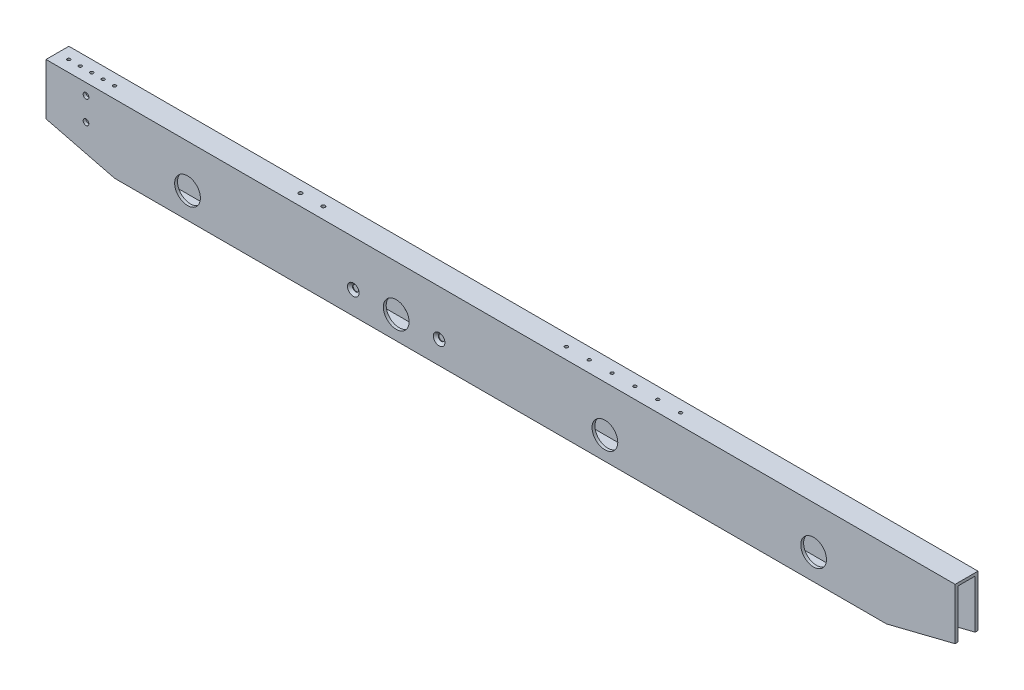
from build123d import *

# Parameters (mm, degrees)
SKETCH1_W                                           = 1009.65
SKETCH1_H                                           = 76.2
SKETCH1_R                                           = 14.2875
BOSS_EXTRUDE2_DEPTH                                 = 12.7
SKETCH3_W                                           = 19.05
SKETCH3_H                                           = 69.85
CUT_EXTRUDE2_DEPTH                                  = 1011.448426442
CUT_EXTRUDE3_DEPTH                                  = 507.897475457
SKETCH9_R                                           = 1.7272
CUT_EXTRUDE5_DEPTH                                  = 6.35
SKETCH12_R                                          = 1.7272
CUT_EXTRUDE8_DEPTH                                  = 5.08
CSK_FOR_1_4_FLAT_HEAD_MACHINE_SCREW_100_D           = 6.7564
CSK_FOR_1_4_FLAT_HEAD_MACHINE_SCREW_100_CSINK_D     = 12.8778
CSK_FOR_1_4_FLAT_HEAD_MACHINE_SCREW_100_CSINK_ANGLE = 100
CUT_EXTRUDE9_START                                  = -6.35
SKETCH15_R                                          = 1.7272
CUT_EXTRUDE9_DEPTH                                  = 6.35
SKETCH16_R                                          = 17.4625
CUT_EXTRUDE10_DEPTH                                 = 3.81
F_1_4_0_25_DIAMETER_HOLE1_D                         = 6.35
F_10_32_TAPPED_HOLE3_D                              = 4.0386


with BuildPart() as part:
    # Sketch1 → Boss-Extrude2 (new, symmetric)
    with BuildSketch(Plane.XY):
        Rectangle(SKETCH1_W, SKETCH1_H)
        with Locations((115.8875, -12.7)):
            Circle(SKETCH1_R, mode=Mode.SUBTRACT)
        with Locations((-347.6625, -9.525)):
            Circle(SKETCH1_R, mode=Mode.SUBTRACT)
        with Locations((347.6625, -9.525)):
            Circle(SKETCH1_R, mode=Mode.SUBTRACT)
        with Locations((-115.8875, -12.7)):
            Circle(SKETCH1_R, mode=Mode.SUBTRACT)
    extrude(amount=BOSS_EXTRUDE2_DEPTH, both=True)

    # Sketch3 → Cut-Extrude2 (cut, through all)
    with BuildSketch(Plane(origin=(504.825, 0, 0), x_dir=(0, 0, -1), z_dir=(1, 0, 0))):
        Rectangle(SKETCH3_W, SKETCH3_H)
    extrude(amount=-CUT_EXTRUDE2_DEPTH, mode=Mode.SUBTRACT)

    # Sketch4 → Cut-Extrude3 (cut, through all)
    with BuildSketch(Plane.XY.offset(12.7)):
        Polygon((-504.825, -38.1), (-504.825, -19.05), (-428.625, -38.1), align=None)
        Polygon((428.625, -38.1), (504.825, -38.1), (504.825, -19.05), align=None)
    extrude(amount=-CUT_EXTRUDE3_DEPTH, mode=Mode.SUBTRACT)

    # Sketch9 → Cut-Extrude5 (cut)
    with BuildSketch(Plane(origin=(0, 38.1, 0), x_dir=(1, 0, 0), z_dir=(0, 1, 0))):
        with Locations((-492.125, 0)):
            Circle(SKETCH9_R)
        with Locations((-441.325, 0)):
            Circle(SKETCH9_R)
        with Locations((-479.425, 0)):
            Circle(SKETCH9_R)
        with Locations((-466.725, 0)):
            Circle(SKETCH9_R)
        with Locations((-454.025, 0)):
            Circle(SKETCH9_R)
    extrude(amount=-CUT_EXTRUDE5_DEPTH, mode=Mode.SUBTRACT)

    # Sketch12 → Cut-Extrude8 (cut)
    with BuildSketch(Plane(origin=(0, 38.1, 0), x_dir=(1, 0, 0), z_dir=(0, 1, 0))):
        with Locations((187.325, 0)):
            Circle(SKETCH12_R)
        with Locations((161.925, 0)):
            Circle(SKETCH12_R)
        with Locations((136.525, 0)):
            Circle(SKETCH12_R)
        with Locations((111.125, 0)):
            Circle(SKETCH12_R)
        with Locations((85.725, 0)):
            Circle(SKETCH12_R)
        with Locations((60.325, 0)):
            Circle(SKETCH12_R)
    extrude(amount=-CUT_EXTRUDE8_DEPTH, mode=Mode.SUBTRACT)

    # CSK for 1/4 Flat Head Machine Screw (100)1 (through all)
    with Locations(Plane.XY.offset(12.7)):
        with Locations((-68.2625, -12.7), (-163.5125, -12.7)):
            CounterSinkHole(CSK_FOR_1_4_FLAT_HEAD_MACHINE_SCREW_100_D / 2, CSK_FOR_1_4_FLAT_HEAD_MACHINE_SCREW_100_CSINK_D / 2, counter_sink_angle=CSK_FOR_1_4_FLAT_HEAD_MACHINE_SCREW_100_CSINK_ANGLE)

    # Sketch15 → Cut-Extrude9 (cut)
    with BuildSketch(Plane(origin=(0, -38.1, 0), x_dir=(-1, 0, 0), z_dir=(0, -1, 0)).offset(CUT_EXTRUDE9_START)):
        with Locations((396.875, 0)):
            Circle(SKETCH15_R)
        with Locations((320.675, 0)):
            Circle(SKETCH15_R)
        with Locations((244.475, 0)):
            Circle(SKETCH15_R)
        with Locations((168.275, 0)):
            Circle(SKETCH15_R)
        with Locations((92.075, 0)):
            Circle(SKETCH15_R)
        with Locations((15.875, 0)):
            Circle(SKETCH15_R)
        with Locations((-60.325, 0)):
            Circle(SKETCH15_R)
    extrude(amount=CUT_EXTRUDE9_DEPTH, mode=Mode.SUBTRACT)

    # Sketch16 → Cut-Extrude10 (cut)
    with BuildSketch(Plane(origin=(0, 0, -12.7), x_dir=(-1, 0, 0), z_dir=(0, 0, -1))):
        with Locations((115.8875, -12.7)):
            Circle(SKETCH16_R)
    extrude(amount=-CUT_EXTRUDE10_DEPTH, mode=Mode.SUBTRACT)

    # 1/4 (0.25) Diameter Hole1 (through all)
    with Locations(Plane.XY.offset(12.7)):
        with Locations((-460.375, 25.4), (-460.375, 0)):
            Hole(F_1_4_0_25_DIAMETER_HOLE1_D / 2)

    # #10-32 Tapped Hole3 (through all)
    with Locations(Plane(origin=(0, 38.1, 0), x_dir=(1, 0, 0), z_dir=(0, 1, 0))):
        with Locations((-234.95, 0), (-209.55, 0)):
            Hole(F_10_32_TAPPED_HOLE3_D / 2)


solid = part.part
